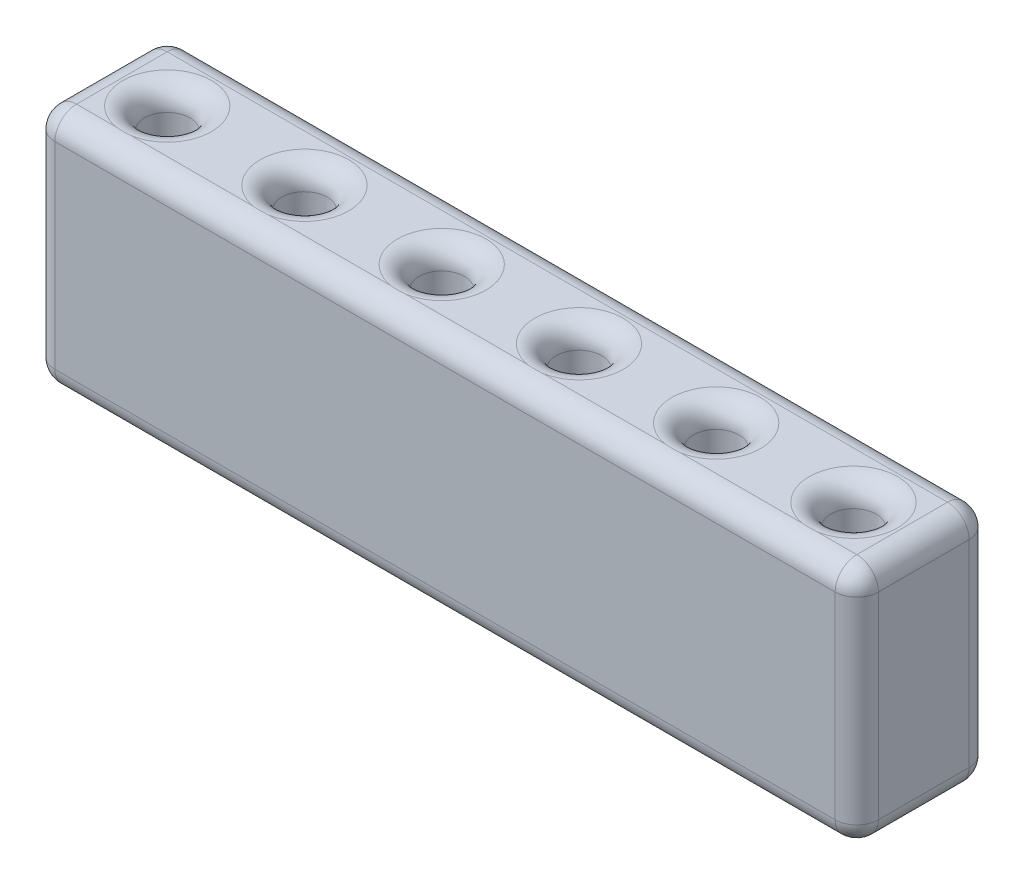
from build123d import *

# Parameters (mm, degrees)
SKETCH1_W           = 76.2
SKETCH1_H           = 22.2504
BOSS_EXTRUDE1_DEPTH = 12.3952
CUT_EXTRUDE1_REACH  = 82.344
SKETCH2_R           = 2.1
FILLET1_R           = 2


with BuildPart() as part:
    # Sketch1 → Boss-Extrude1 (new body)
    with BuildSketch(Plane.XY):
        with Locations((-38.1, -11.1252)):
            Rectangle(SKETCH1_W, SKETCH1_H)
    extrude(amount=BOSS_EXTRUDE1_DEPTH)

    # Sketch2 → Cut-Extrude1 (cut, up to next)
    with BuildSketch(Plane(origin=(0, 0, 0), x_dir=(1, 0, 0), z_dir=(0, 1, 0)), mode=Mode.PRIVATE) as cut_extrude1_sk1:
        with Locations(Location((-69.85, -6.35, 0), (0, 0, 180))):
            Circle(SKETCH2_R)
    cut_extrude1_tool1 = extrude(cut_extrude1_sk1.sketch, amount=-CUT_EXTRUDE1_REACH, mode=Mode.PRIVATE) & part.part
    # Sketch2 → Cut-Extrude1 (cut, up to next)
    with BuildSketch(Plane(origin=(0, 0, 0), x_dir=(1, 0, 0), z_dir=(0, 1, 0)), mode=Mode.PRIVATE) as cut_extrude1_sk2:
        with Locations(Location((-57.15, -6.35, 0), (0, 0, 180))):
            Circle(SKETCH2_R)
    cut_extrude1_tool2 = extrude(cut_extrude1_sk2.sketch, amount=-CUT_EXTRUDE1_REACH, mode=Mode.PRIVATE) & part.part
    # Sketch2 → Cut-Extrude1 (cut, up to next)
    with BuildSketch(Plane(origin=(0, 0, 0), x_dir=(1, 0, 0), z_dir=(0, 1, 0)), mode=Mode.PRIVATE) as cut_extrude1_sk3:
        with Locations(Location((-44.45, -6.35, 0), (0, 0, 180))):
            Circle(SKETCH2_R)
    cut_extrude1_tool3 = extrude(cut_extrude1_sk3.sketch, amount=-CUT_EXTRUDE1_REACH, mode=Mode.PRIVATE) & part.part
    # Sketch2 → Cut-Extrude1 (cut, up to next)
    with BuildSketch(Plane(origin=(0, 0, 0), x_dir=(1, 0, 0), z_dir=(0, 1, 0)), mode=Mode.PRIVATE) as cut_extrude1_sk4:
        with Locations(Location((-31.75, -6.35, 0), (0, 0, 180))):
            Circle(SKETCH2_R)
    cut_extrude1_tool4 = extrude(cut_extrude1_sk4.sketch, amount=-CUT_EXTRUDE1_REACH, mode=Mode.PRIVATE) & part.part
    # Sketch2 → Cut-Extrude1 (cut, up to next)
    with BuildSketch(Plane(origin=(0, 0, 0), x_dir=(1, 0, 0), z_dir=(0, 1, 0)), mode=Mode.PRIVATE) as cut_extrude1_sk5:
        with Locations(Location((-19.05, -6.35, 0), (0, 0, 180))):
            Circle(SKETCH2_R)
    cut_extrude1_tool5 = extrude(cut_extrude1_sk5.sketch, amount=-CUT_EXTRUDE1_REACH, mode=Mode.PRIVATE) & part.part
    # Sketch2 → Cut-Extrude1 (cut, up to next)
    with BuildSketch(Plane(origin=(0, 0, 0), x_dir=(1, 0, 0), z_dir=(0, 1, 0)), mode=Mode.PRIVATE) as cut_extrude1_sk6:
        with Locations(Location((-6.35, -6.35, 0), (0, 0, 180))):
            Circle(SKETCH2_R)
    cut_extrude1_tool6 = extrude(cut_extrude1_sk6.sketch, amount=-CUT_EXTRUDE1_REACH, mode=Mode.PRIVATE) & part.part
    add(cut_extrude1_tool1.solids().sort_by_distance((-69.85, 0, 6.35))[0], mode=Mode.SUBTRACT)
    add(cut_extrude1_tool2.solids().sort_by_distance((-57.15, 0, 6.35))[0], mode=Mode.SUBTRACT)
    add(cut_extrude1_tool3.solids().sort_by_distance((-44.45, 0, 6.35))[0], mode=Mode.SUBTRACT)
    add(cut_extrude1_tool4.solids().sort_by_distance((-31.75, 0, 6.35))[0], mode=Mode.SUBTRACT)
    add(cut_extrude1_tool5.solids().sort_by_distance((-19.05, 0, 6.35))[0], mode=Mode.SUBTRACT)
    add(cut_extrude1_tool6.solids().sort_by_distance((-6.35, 0, 6.35))[0], mode=Mode.SUBTRACT)

    # Fillet1
    # the kernel refuses this fillet: 2 mm, written as the material it takes off along each edge
    with BuildSketch(Plane(origin=(-74.2, -2, 10.3952), x_dir=(0, 0, 1), z_dir=(0, 1, 0))) as fillet1_piece_1_section:
        Polygon((0, 0), (FILLET1_R, 0), (FILLET1_R, -FILLET1_R), (0, -FILLET1_R), align=None)
    fillet1_piece_1 = extrude(amount=FILLET1_R, mode=Mode.PRIVATE)
    fillet1_piece_1 = fillet1_piece_1 - Plane(origin=(-74.2, -2, 10.3952), x_dir=(0.7071067811865475, 0, -0.7071067811865475), z_dir=(0, 1, 0)) * Sphere(FILLET1_R, mode=Mode.PRIVATE)
    add(fillet1_piece_1, mode=Mode.SUBTRACT)
    with BuildSketch(Plane(origin=(-74.2, -20.2504, 10.3952), x_dir=(0, 0, 1), z_dir=(0, -1, 0))) as fillet1_piece_2_section:
        Polygon((0, 0), (FILLET1_R, 0), (FILLET1_R, FILLET1_R), (0, FILLET1_R), align=None)
    fillet1_piece_2 = extrude(amount=FILLET1_R, mode=Mode.PRIVATE)
    fillet1_piece_2 = fillet1_piece_2 - Plane(origin=(-74.2, -20.2504, 10.3952), x_dir=(0.7071067811865475, 0, -0.7071067811865475), z_dir=(0, -1, 0)) * Sphere(FILLET1_R, mode=Mode.PRIVATE)
    add(fillet1_piece_2, mode=Mode.SUBTRACT)
    with BuildSketch(Plane(origin=(-2, -20.2504, 10.3952), x_dir=(1, 0, 0), z_dir=(0, -1, 0))) as fillet1_piece_3_section:
        Polygon((0, 0), (FILLET1_R, 0), (FILLET1_R, FILLET1_R), (0, FILLET1_R), align=None)
    fillet1_piece_3 = extrude(amount=FILLET1_R, mode=Mode.PRIVATE)
    fillet1_piece_3 = fillet1_piece_3 - Plane(origin=(-2, -20.2504, 10.3952), x_dir=(-0.7071067811865475, 0, -0.7071067811865475), z_dir=(0, -1, 0)) * Sphere(FILLET1_R, mode=Mode.PRIVATE)
    add(fillet1_piece_3, mode=Mode.SUBTRACT)
    with BuildSketch(Plane(origin=(-2, -2, 10.3952), x_dir=(1, 0, 0), z_dir=(0, 1, 0))) as fillet1_piece_4_section:
        Polygon((0, 0), (FILLET1_R, 0), (FILLET1_R, -FILLET1_R), (0, -FILLET1_R), align=None)
    fillet1_piece_4 = extrude(amount=FILLET1_R, mode=Mode.PRIVATE)
    fillet1_piece_4 = fillet1_piece_4 - Plane(origin=(-2, -2, 10.3952), x_dir=(-0.7071067811865475, 0, -0.7071067811865475), z_dir=(0, 1, 0)) * Sphere(FILLET1_R, mode=Mode.PRIVATE)
    add(fillet1_piece_4, mode=Mode.SUBTRACT)
    with BuildSketch(Plane(origin=(-74.2, -20.2504, 2), x_dir=(0, -1, 0), z_dir=(0, 0, -1))) as fillet1_piece_5_section:
        Polygon((0, 0), (FILLET1_R, 0), (FILLET1_R, FILLET1_R), (0, FILLET1_R), align=None)
    fillet1_piece_5 = extrude(amount=FILLET1_R, mode=Mode.PRIVATE)
    fillet1_piece_5 = fillet1_piece_5 - Plane(origin=(-74.2, -20.2504, 2), x_dir=(0.7071067811865475, 0.7071067811865476, 0), z_dir=(0, 0, -1)) * Sphere(FILLET1_R, mode=Mode.PRIVATE)
    add(fillet1_piece_5, mode=Mode.SUBTRACT)
    with BuildSketch(Plane(origin=(-2, -20.2504, 2), x_dir=(0, 0, -1), z_dir=(1, 0, 0))) as fillet1_piece_6_section:
        Polygon((0, 0), (FILLET1_R, 0), (FILLET1_R, -FILLET1_R), (0, -FILLET1_R), align=None)
    fillet1_piece_6 = extrude(amount=FILLET1_R, mode=Mode.PRIVATE)
    fillet1_piece_6 = fillet1_piece_6 - Plane(origin=(-2, -20.2504, 2), x_dir=(0, 0.7071067811865475, 0.7071067811865475), z_dir=(1, 0, 0)) * Sphere(FILLET1_R, mode=Mode.PRIVATE)
    add(fillet1_piece_6, mode=Mode.SUBTRACT)
    with BuildSketch(Plane(origin=(-74.2, -2, 2), x_dir=(0, 0, -1), z_dir=(0, 1, 0))) as fillet1_piece_7_section:
        Polygon((0, 0), (FILLET1_R, 0), (FILLET1_R, FILLET1_R), (0, FILLET1_R), align=None)
    fillet1_piece_7 = extrude(amount=FILLET1_R, mode=Mode.PRIVATE)
    fillet1_piece_7 = fillet1_piece_7 - Plane(origin=(-74.2, -2, 2), x_dir=(0.7071067811865475, 0, 0.7071067811865475), z_dir=(0, 1, 0)) * Sphere(FILLET1_R, mode=Mode.PRIVATE)
    add(fillet1_piece_7, mode=Mode.SUBTRACT)
    with BuildSketch(Plane(origin=(-2, -2, 2), x_dir=(1, 0, 0), z_dir=(0, 1, 0))) as fillet1_piece_8_section:
        Polygon((0, 0), (FILLET1_R, 0), (FILLET1_R, FILLET1_R), (0, FILLET1_R), align=None)
    fillet1_piece_8 = extrude(amount=FILLET1_R, mode=Mode.PRIVATE)
    fillet1_piece_8 = fillet1_piece_8 - Plane(origin=(-2, -2, 2), x_dir=(-0.7071067811865475, 0, 0.7071067811865475), z_dir=(0, 1, 0)) * Sphere(FILLET1_R, mode=Mode.PRIVATE)
    add(fillet1_piece_8, mode=Mode.SUBTRACT)
    with BuildSketch(Plane(origin=(-76.2, -2, 12.3952), x_dir=(1, 0, 0), z_dir=(0, -1, 0)), Plane(origin=(0, -20.2504, 0), x_dir=(0, 0, 1), z_dir=(0, 1, 0))) as fillet1_piece_9:
        with BuildLine():
            CenterArc((FILLET1_R, -FILLET1_R), FILLET1_R, 90, 90)
            Line((0, -FILLET1_R), (0, 0))
            Line((0, 0), (FILLET1_R, 0))
        make_face()
    extrude(amount=18.2504, mode=Mode.SUBTRACT)
    with BuildSketch(Plane(origin=(-74.2, -22.2504, 12.3952), x_dir=(0, 1, 0), z_dir=(1, 0, 0)), Plane(origin=(-2, 0, 0), x_dir=(0, 0, 1), z_dir=(-1, 0, 0))) as fillet1_piece_10:
        with BuildLine():
            CenterArc((FILLET1_R, -FILLET1_R), FILLET1_R, 90, 90)
            Line((0, -FILLET1_R), (0, 0))
            Line((0, 0), (FILLET1_R, 0))
        make_face()
    extrude(amount=72.2, mode=Mode.SUBTRACT)
    with BuildSketch(Plane(origin=(-69.85, 0, 6.35), x_dir=(-1, 0, 0), z_dir=(0, 0, -1))) as fillet1_piece_11:
        with BuildLine():
            CenterArc((2.1 + FILLET1_R, -FILLET1_R), FILLET1_R, 90, 90)
            Line((2.1, -FILLET1_R), (2.1, 0))
            Line((2.1, 0), (2.1 + FILLET1_R, 0))
        make_face()
    revolve(axis=Axis((-69.85, 0, 6.35), (0, 1, 0)), mode=Mode.SUBTRACT)
    with BuildSketch(Plane(origin=(-69.85, -22.2504, 6.35), x_dir=(-1, 0, 0), z_dir=(0, 0, -1))) as fillet1_piece_12:
        with BuildLine():
            CenterArc((2.1 + FILLET1_R, FILLET1_R), FILLET1_R, 180, 90)
            Line((2.1 + FILLET1_R, 0), (2.1, 0))
            Line((2.1, 0), (2.1, FILLET1_R))
        make_face()
    revolve(axis=Axis((-69.85, -22.2504, 6.35), (0, 1, 0)), mode=Mode.SUBTRACT)
    with BuildSketch(Plane(origin=(-57.15, 0, 6.35), x_dir=(-1, 0, 0), z_dir=(0, 0, -1))) as fillet1_piece_13:
        with BuildLine():
            CenterArc((2.1 + FILLET1_R, -FILLET1_R), FILLET1_R, 90, 90)
            Line((2.1, -FILLET1_R), (2.1, 0))
            Line((2.1, 0), (2.1 + FILLET1_R, 0))
        make_face()
    revolve(axis=Axis((-57.15, 0, 6.35), (0, 1, 0)), mode=Mode.SUBTRACT)
    with BuildSketch(Plane(origin=(-57.15, -22.2504, 6.35), x_dir=(-1, 0, 0), z_dir=(0, 0, -1))) as fillet1_piece_14:
        with BuildLine():
            CenterArc((2.1 + FILLET1_R, FILLET1_R), FILLET1_R, 180, 90)
            Line((2.1 + FILLET1_R, 0), (2.1, 0))
            Line((2.1, 0), (2.1, FILLET1_R))
        make_face()
    revolve(axis=Axis((-57.15, -22.2504, 6.35), (0, 1, 0)), mode=Mode.SUBTRACT)
    with BuildSketch(Plane(origin=(-44.45, 0, 6.35), x_dir=(-1, 0, 0), z_dir=(0, 0, -1))) as fillet1_piece_15:
        with BuildLine():
            CenterArc((2.1 + FILLET1_R, -FILLET1_R), FILLET1_R, 90, 90)
            Line((2.1, -FILLET1_R), (2.1, 0))
            Line((2.1, 0), (2.1 + FILLET1_R, 0))
        make_face()
    revolve(axis=Axis((-44.45, 0, 6.35), (0, 1, 0)), mode=Mode.SUBTRACT)
    with BuildSketch(Plane(origin=(-44.45, -22.2504, 6.35), x_dir=(-1, 0, 0), z_dir=(0, 0, -1))) as fillet1_piece_16:
        with BuildLine():
            CenterArc((2.1 + FILLET1_R, FILLET1_R), FILLET1_R, 180, 90)
            Line((2.1 + FILLET1_R, 0), (2.1, 0))
            Line((2.1, 0), (2.1, FILLET1_R))
        make_face()
    revolve(axis=Axis((-44.45, -22.2504, 6.35), (0, 1, 0)), mode=Mode.SUBTRACT)
    with BuildSketch(Plane(origin=(-31.75, 0, 6.35), x_dir=(-1, 0, 0), z_dir=(0, 0, -1))) as fillet1_piece_17:
        with BuildLine():
            CenterArc((2.1 + FILLET1_R, -FILLET1_R), FILLET1_R, 90, 90)
            Line((2.1, -FILLET1_R), (2.1, 0))
            Line((2.1, 0), (2.1 + FILLET1_R, 0))
        make_face()
    revolve(axis=Axis((-31.75, 0, 6.35), (0, 1, 0)), mode=Mode.SUBTRACT)
    with BuildSketch(Plane(origin=(-31.75, -22.2504, 6.35), x_dir=(-1, 0, 0), z_dir=(0, 0, -1))) as fillet1_piece_18:
        with BuildLine():
            CenterArc((2.1 + FILLET1_R, FILLET1_R), FILLET1_R, 180, 90)
            Line((2.1 + FILLET1_R, 0), (2.1, 0))
            Line((2.1, 0), (2.1, FILLET1_R))
        make_face()
    revolve(axis=Axis((-31.75, -22.2504, 6.35), (0, 1, 0)), mode=Mode.SUBTRACT)
    with BuildSketch(Plane(origin=(-19.05, 0, 6.35), x_dir=(-1, 0, 0), z_dir=(0, 0, -1))) as fillet1_piece_19:
        with BuildLine():
            CenterArc((2.1 + FILLET1_R, -FILLET1_R), FILLET1_R, 90, 90)
            Line((2.1, -FILLET1_R), (2.1, 0))
            Line((2.1, 0), (2.1 + FILLET1_R, 0))
        make_face()
    revolve(axis=Axis((-19.05, 0, 6.35), (0, 1, 0)), mode=Mode.SUBTRACT)
    with BuildSketch(Plane(origin=(-19.05, -22.2504, 6.35), x_dir=(-1, 0, 0), z_dir=(0, 0, -1))) as fillet1_piece_20:
        with BuildLine():
            CenterArc((2.1 + FILLET1_R, FILLET1_R), FILLET1_R, 180, 90)
            Line((2.1 + FILLET1_R, 0), (2.1, 0))
            Line((2.1, 0), (2.1, FILLET1_R))
        make_face()
    revolve(axis=Axis((-19.05, -22.2504, 6.35), (0, 1, 0)), mode=Mode.SUBTRACT)
    with BuildSketch(Plane(origin=(-6.35, 0, 6.35), x_dir=(-1, 0, 0), z_dir=(0, 0, -1))) as fillet1_piece_21:
        with BuildLine():
            CenterArc((2.1 + FILLET1_R, -FILLET1_R), FILLET1_R, 90, 90)
            Line((2.1, -FILLET1_R), (2.1, 0))
            Line((2.1, 0), (2.1 + FILLET1_R, 0))
        make_face()
    revolve(axis=Axis((-6.35, 0, 6.35), (0, 1, 0)), mode=Mode.SUBTRACT)
    with BuildSketch(Plane(origin=(-6.35, -22.2504, 6.35), x_dir=(-1, 0, 0), z_dir=(0, 0, -1))) as fillet1_piece_22:
        with BuildLine():
            CenterArc((2.1 + FILLET1_R, FILLET1_R), FILLET1_R, 180, 90)
            Line((2.1 + FILLET1_R, 0), (2.1, 0))
            Line((2.1, 0), (2.1, FILLET1_R))
        make_face()
    revolve(axis=Axis((-6.35, -22.2504, 6.35), (0, 1, 0)), mode=Mode.SUBTRACT)
    with BuildSketch(Plane(origin=(0, -20.2504, 12.3952), x_dir=(0, 0, -1), z_dir=(0, 1, 0)), Plane(origin=(-76.2, -2, 0), x_dir=(1, 0, 0), z_dir=(0, -1, 0))) as fillet1_piece_23:
        with BuildLine():
            CenterArc((FILLET1_R, FILLET1_R), FILLET1_R, 180, 90)
            Line((0, FILLET1_R), (0, 0))
            Line((0, 0), (FILLET1_R, 0))
        make_face()
    extrude(amount=18.2504, mode=Mode.SUBTRACT)
    with BuildSketch(Plane(origin=(-74.2, -22.2504, 0), x_dir=(0, 1, 0), z_dir=(1, 0, 0)), Plane(origin=(-2, 0, 12.3952), x_dir=(0, 0, -1), z_dir=(-1, 0, 0))) as fillet1_piece_24:
        with BuildLine():
            CenterArc((FILLET1_R, FILLET1_R), FILLET1_R, 180, 90)
            Line((0, FILLET1_R), (0, 0))
            Line((0, 0), (FILLET1_R, 0))
        make_face()
    extrude(amount=72.2, mode=Mode.SUBTRACT)
    with BuildSketch(Plane(origin=(0, -22.2504, 2), x_dir=(0, 1, 0), z_dir=(0, 0, 1)), Plane(origin=(0, 0, 2), x_dir=(-1, 0, 0), z_dir=(0, 0, 1))) as fillet1_piece_25:
        with BuildLine():
            CenterArc((FILLET1_R, FILLET1_R), FILLET1_R, 180, 90)
            Line((0, FILLET1_R), (0, 0))
            Line((0, 0), (FILLET1_R, 0))
        make_face()
    extrude(amount=8.3952, mode=Mode.SUBTRACT)
    with BuildSketch(Plane(origin=(-76.2, -22.2504, 2), x_dir=(0, 1, 0), z_dir=(0, 0, 1)), Plane(origin=(-76.2, 0, 2), x_dir=(1, 0, 0), z_dir=(0, 0, 1))) as fillet1_piece_26:
        with BuildLine():
            CenterArc((FILLET1_R, -FILLET1_R), FILLET1_R, 90, 90)
            Line((0, -FILLET1_R), (0, 0))
            Line((0, 0), (FILLET1_R, 0))
        make_face()
    extrude(amount=8.3952, mode=Mode.SUBTRACT)


solid = part.part
